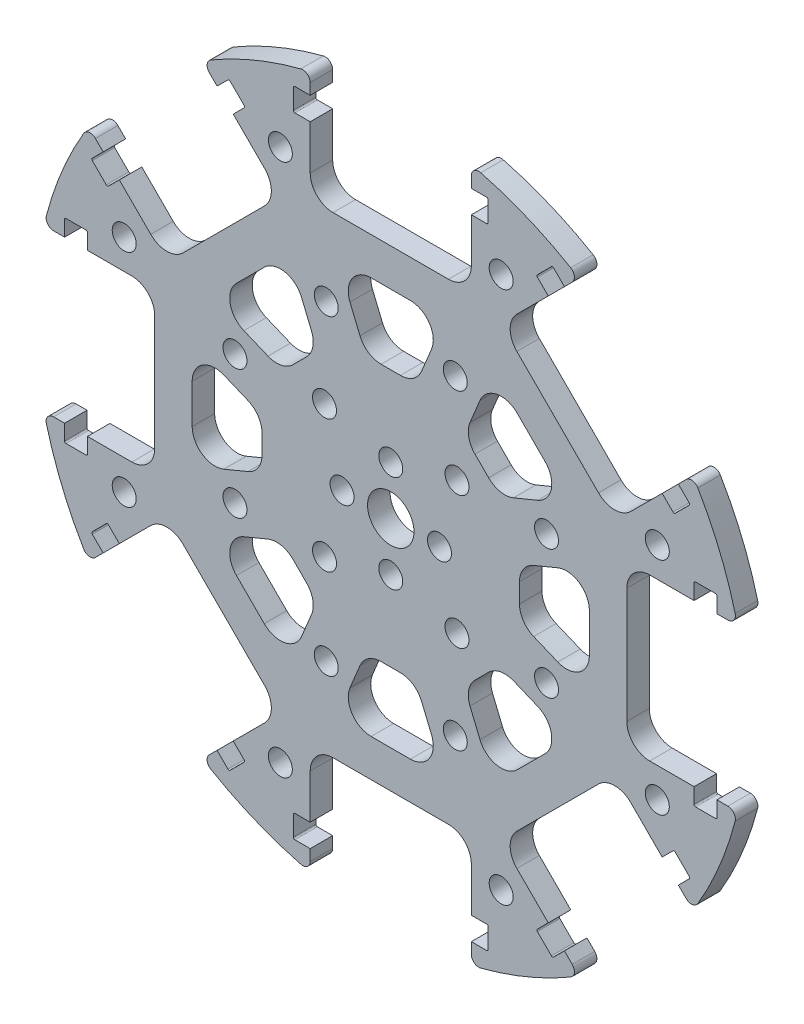
from build123d import *

# Parameters (mm, degrees)
SKETCH_1_R                       = 47.5
EXTRUDE_1_DEPTH                  = 3
CUT_EXTRUDE_1_DEPTH              = 68.242099908
CUT_EXTRUDE_2_DEPTH              = 68.242099908
CUT_EXTRUDE_2_DEPTH_BACK         = 68.242099908
SKETCH_3_R                       = 3.1
SKETCH_3_R_2                     = 1.6
SKETCH_4_R                       = 1.6
CUT_EXTRUDE_3_DEPTH              = 68.242099908
CUT_EXTRUDE_4_DEPTH              = 68.242099908
FILLET_1_R                       = 1
FILLET_2_R                       = 0.2
FILLET_3_R                       = 3.05
FILLET_4_R                       = 3.05
PATTERN_CIRCULAR_1_COUNT         = 8
FILLET_1_OF_PATTERN_CIRCULAR_1_R = 1
FILLET_2_OF_PATTERN_CIRCULAR_1_R = 0.2
FILLET_3_OF_PATTERN_CIRCULAR_1_R = 3.05
FILLET_4_OF_PATTERN_CIRCULAR_1_R = 3.05


with BuildPart() as part:
    # ｽｹｯﾁ1 → ﾎﾞｽ - 押し出し1 (new body)
    with BuildSketch(Plane.XY):
        Circle(SKETCH_1_R)
    extrude(amount=EXTRUDE_1_DEPTH)

    # ｽｹｯﾁ2 → ｶｯﾄ - 押し出し1 (cut, through all)
    with BuildSketch(Plane.XY.offset(3)):
        Polygon((-10.75, 43.525), (-10.75, 52.5), (10.75, 52.5), (10.75, 43.525), (13, 43.525), (13, 40.475), (10.75, 40.475), (10.75, 31.5), (-10.75, 31.5), (-10.75, 40.475), (-13, 40.475), (-13, 43.525), align=None)
    cut_extrude_1 = extrude(amount=-CUT_EXTRUDE_1_DEPTH, mode=Mode.SUBTRACT)

    # ｽｹｯﾁ3 → ｶｯﾄ - 押し出し2 (cut, two sides: drawn at the far end of the back side and taken through both)
    with BuildSketch(Plane.XY.offset(3).offset(-CUT_EXTRUDE_2_DEPTH_BACK)):
        Circle(SKETCH_3_R)
        with Locations((0, 6.5)):
            Circle(SKETCH_3_R_2)
        with Locations((6.5, 0)):
            Circle(SKETCH_3_R_2)
        with Locations((0, -6.5)):
            Circle(SKETCH_3_R_2)
        with Locations((-6.5, 0)):
            Circle(SKETCH_3_R_2)
        with Locations((8.838834765, 8.838834765)):
            Circle(SKETCH_3_R_2)
        with Locations((8.838834765, -8.838834765)):
            Circle(SKETCH_3_R_2)
        with Locations((-8.838834765, -8.838834765)):
            Circle(SKETCH_3_R_2)
        with Locations((-8.838834765, 8.838834765)):
            Circle(SKETCH_3_R_2)
    extrude(amount=CUT_EXTRUDE_2_DEPTH + CUT_EXTRUDE_2_DEPTH_BACK, mode=Mode.SUBTRACT)

    # ｽｹｯﾁ4 → ｶｯﾄ - 押し出し3 (cut, through all)
    with BuildSketch(Plane.XY.offset(3)):
        with Locations((14.733312146, 35.569362002)):
            Circle(SKETCH_4_R)
        with Locations((8.610377228, 20.787289482)):
            Circle(SKETCH_4_R)
    cut_extrude_3 = extrude(amount=-CUT_EXTRUDE_3_DEPTH, mode=Mode.SUBTRACT)

    # ｽｹｯﾁ5 → ｶｯﾄ - 押し出し4 (cut, symmetric)
    with BuildSketch(Plane.XY.offset(3)):
        Polygon((-7.188286702, 26.5), (7.188286702, 26.5), (3.328075632, 17.180626082), (-3.328075632, 17.180626082), align=None)
    cut_extrude_4 = extrude(amount=CUT_EXTRUDE_4_DEPTH, both=True, mode=Mode.SUBTRACT)

    # ﾌｨﾚｯﾄ1
    fillet_1_edges = [part.edges().sort_by_distance(p)[0] for p in [
        (10.75, 46.267564232, 1.5),
        (-10.75, 46.267564232, 1.5),
    ]]
    fillet(fillet_1_edges, radius=FILLET_1_R)

    # ﾌｨﾚｯﾄ2
    fillet_2_edges = [part.edges().sort_by_distance(p)[0] for p in [
        (13, 43.525, 1.5),
        (13, 40.475, 1.5),
        (-13, 43.525, 1.5),
        (-13, 40.475, 1.5),
    ]]
    fillet(fillet_2_edges, radius=FILLET_2_R)

    # ﾌｨﾚｯﾄ3
    fillet_3_edges = [part.edges().sort_by_distance(p)[0] for p in [
        (10.75, 31.5, 1.5),
        (-10.75, 31.5, 1.5),
    ]]
    fillet(fillet_3_edges, radius=FILLET_3_R)

    # ﾌｨﾚｯﾄ4
    fillet_4_edges = [part.edges().sort_by_distance(p)[0] for p in [
        (7.188286702, 26.5, 1.5),
        (3.328075632, 17.180626082, 1.5),
        (-3.328075632, 17.180626082, 1.5),
        (-7.188286702, 26.5, 1.5),
    ]]
    fillet(fillet_4_edges, radius=FILLET_4_R)

    # 円形ﾊﾟﾀｰﾝ1: ｶｯﾄ - 押し出し1, ｶｯﾄ - 押し出し3, ｶｯﾄ - 押し出し4 ×8 about axis
    pattern_circular_1_axis = Axis((0, 0, 0), (0, 0, 1))
    add([cut_extrude_1.rotate(pattern_circular_1_axis, i * 360 / PATTERN_CIRCULAR_1_COUNT) for i in range(1, PATTERN_CIRCULAR_1_COUNT)], mode=Mode.SUBTRACT)
    add([cut_extrude_3.rotate(pattern_circular_1_axis, i * 360 / PATTERN_CIRCULAR_1_COUNT) for i in range(1, PATTERN_CIRCULAR_1_COUNT)], mode=Mode.SUBTRACT)
    add([cut_extrude_4.rotate(pattern_circular_1_axis, i * 360 / PATTERN_CIRCULAR_1_COUNT) for i in range(1, PATTERN_CIRCULAR_1_COUNT)], mode=Mode.SUBTRACT)

    # ﾌｨﾚｯﾄ1 of 円形ﾊﾟﾀｰﾝ1
    fillet_1_of_pattern_circular_1_edges = [part.edges().sort_by_distance(p)[0] for p in [
        (-25.11471052, 40.317506315, 1.5),
        (-40.317506315, 25.11471052, 1.5),
        (-46.267564232, 10.75, 1.5),
        (-46.267564232, -10.75, 1.5),
        (-40.317506315, -25.11471052, 1.5),
        (-25.11471052, -40.317506315, 1.5),
        (-10.75, -46.267564232, 1.5),
        (10.75, -46.267564232, 1.5),
        (25.11471052, -40.317506315, 1.5),
        (40.317506315, -25.11471052, 1.5),
        (46.267564232, -10.75, 1.5),
        (46.267564232, 10.75, 1.5),
        (40.317506315, 25.11471052, 1.5),
        (25.11471052, 40.317506315, 1.5),
    ]]
    fillet(fillet_1_of_pattern_circular_1_edges, radius=FILLET_1_OF_PATTERN_CIRCULAR_1_R)

    # ﾌｨﾚｯﾄ2 of 円形ﾊﾟﾀｰﾝ1
    fillet_2_of_pattern_circular_1_edges = [part.edges().sort_by_distance(p)[0] for p in [
        (-21.584434496, 39.969210807, 1.5),
        (-19.427758813, 37.812535124, 1.5),
        (-39.969210807, 21.584434496, 1.5),
        (-37.812535124, 19.427758813, 1.5),
        (-43.525, 13, 1.5),
        (-40.475, 13, 1.5),
        (-43.525, -13, 1.5),
        (-40.475, -13, 1.5),
        (-39.969210807, -21.584434496, 1.5),
        (-37.812535124, -19.427758813, 1.5),
        (-21.584434496, -39.969210807, 1.5),
        (-19.427758813, -37.812535124, 1.5),
        (-13, -43.525, 1.5),
        (-13, -40.475, 1.5),
        (13, -43.525, 1.5),
        (13, -40.475, 1.5),
        (21.584434496, -39.969210807, 1.5),
        (19.427758813, -37.812535124, 1.5),
        (39.969210807, -21.584434496, 1.5),
        (37.812535124, -19.427758813, 1.5),
        (43.525, -13, 1.5),
        (40.475, -13, 1.5),
        (43.525, 13, 1.5),
        (40.475, 13, 1.5),
        (39.969210807, 21.584434496, 1.5),
        (37.812535124, 19.427758813, 1.5),
        (21.584434496, 39.969210807, 1.5),
        (19.427758813, 37.812535124, 1.5),
    ]]
    fillet(fillet_2_of_pattern_circular_1_edges, radius=FILLET_2_OF_PATTERN_CIRCULAR_1_R)

    # ﾌｨﾚｯﾄ3 of 円形ﾊﾟﾀｰﾝ1
    fillet_3_of_pattern_circular_1_edges = [part.edges().sort_by_distance(p)[0] for p in [
        (-14.67246571, 29.875261505, 1.5),
        (-29.875261505, 14.67246571, 1.5),
        (-31.5, 10.75, 1.5),
        (-31.5, -10.75, 1.5),
        (-29.875261505, -14.67246571, 1.5),
        (-14.67246571, -29.875261505, 1.5),
        (-10.75, -31.5, 1.5),
        (10.75, -31.5, 1.5),
        (14.67246571, -29.875261505, 1.5),
        (29.875261505, -14.67246571, 1.5),
        (31.5, -10.75, 1.5),
        (31.5, 10.75, 1.5),
        (29.875261505, 14.67246571, 1.5),
        (14.67246571, 29.875261505, 1.5),
    ]]
    fillet(fillet_3_of_pattern_circular_1_edges, radius=FILLET_3_OF_PATTERN_CIRCULAR_1_R)

    # ﾌｨﾚｯﾄ4 of 円形ﾊﾟﾀｰﾝ1
    fillet_4_of_pattern_circular_1_edges = [part.edges().sort_by_distance(p)[0] for p in [
        (-13.655443429, 23.821215973, 1.5),
        (-9.79523236, 14.501842056, 1.5),
        (-14.501842056, 9.79523236, 1.5),
        (-23.821215973, 13.655443429, 1.5),
        (-26.5, 7.188286702, 1.5),
        (-17.180626082, 3.328075632, 1.5),
        (-17.180626082, -3.328075632, 1.5),
        (-26.5, -7.188286702, 1.5),
        (-23.821215973, -13.655443429, 1.5),
        (-14.501842056, -9.79523236, 1.5),
        (-9.79523236, -14.501842056, 1.5),
        (-13.655443429, -23.821215973, 1.5),
        (-7.188286702, -26.5, 1.5),
        (-3.328075632, -17.180626082, 1.5),
        (3.328075632, -17.180626082, 1.5),
        (7.188286702, -26.5, 1.5),
        (13.655443429, -23.821215973, 1.5),
        (9.79523236, -14.501842056, 1.5),
        (14.501842056, -9.79523236, 1.5),
        (23.821215973, -13.655443429, 1.5),
        (26.5, -7.188286702, 1.5),
        (17.180626082, -3.328075632, 1.5),
        (17.180626082, 3.328075632, 1.5),
        (26.5, 7.188286702, 1.5),
        (23.821215973, 13.655443429, 1.5),
        (14.501842056, 9.79523236, 1.5),
        (9.79523236, 14.501842056, 1.5),
        (13.655443429, 23.821215973, 1.5),
    ]]
    fillet(fillet_4_of_pattern_circular_1_edges, radius=FILLET_4_OF_PATTERN_CIRCULAR_1_R)


solid = part.part
